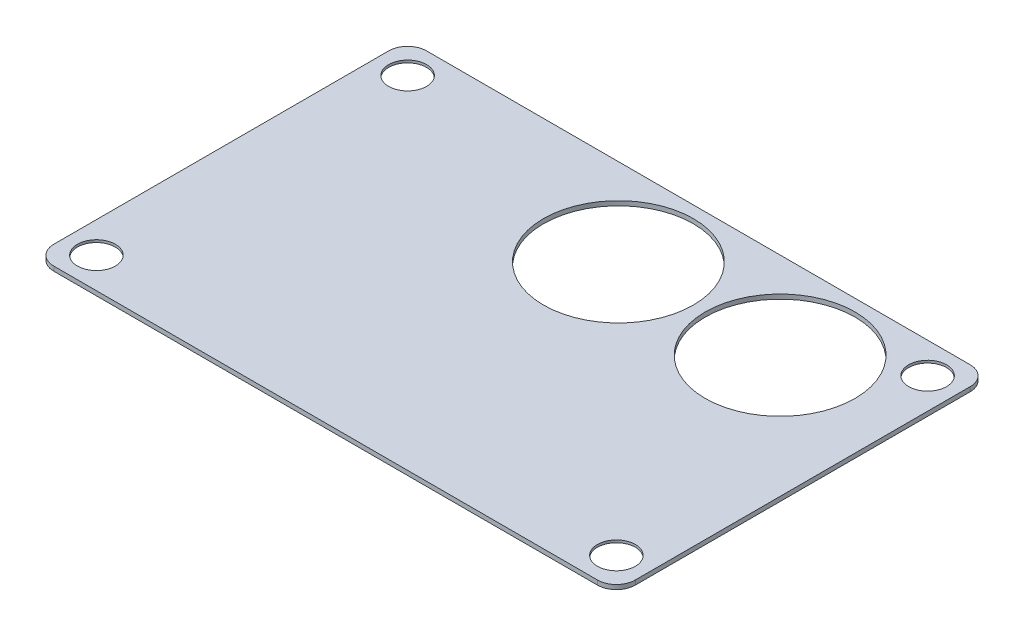
from build123d import *

# Parameters (mm, degrees)
SKETCH1_W               = 78
SKETCH1_H               = 50
PCB_DEPTH               = 0.6
CARD_EDGES_R            = 2.54
SKETCH4_R               = 2.54
MAGNET_HOLE_CUT_DEPTH   = 93.651821353
SKETCH8_R               = 3.33
STEEL_INLAY_CUT_DEPTH   = 0.266625
MIRROR2_COPY_1_SKETCH_R = 2.54
MIRROR2_COPY_1_DEPTH    = 93.651821353
MIRROR2_COPY_2_SKETCH_R = 3.33
MIRROR2_COPY_2_DEPTH    = 0.266625
MIRROR2_COPY_3_SKETCH_R = 2.54
MIRROR2_COPY_3_DEPTH    = 93.651821353
MIRROR2_COPY_4_SKETCH_R = 3.33
MIRROR2_COPY_4_DEPTH    = 0.266625
SKETCH15_R              = 10.05
BATTERY_HOLES_DEPTH     = 93.651821353


with BuildPart() as part:
    # Sketch1 → pcb (new body)
    with BuildSketch(Plane(origin=(0, 0, 0), x_dir=(1, 0, 0), z_dir=(0, 1, 0))):
        with Locations((39, 25)):
            Rectangle(SKETCH1_W, SKETCH1_H)
    extrude(amount=PCB_DEPTH)

    # card edges
    card_edges_edges = [part.edges().sort_by_distance(p)[0] for p in [
        (78, 0.3, -50),
        (0, 0.3, -50),
        (0, 0.3, 0),
        (78, 0.3, 0),
    ]]
    fillet(card_edges_edges, radius=CARD_EDGES_R)

    # Sketch4 → magnet hole cut (cut, through all)
    with BuildSketch(Plane(origin=(0, 0.6, 0), x_dir=(1, 0, 0), z_dir=(0, 1, 0))):
        with Locations((4.1275, 4.13)):
            Circle(SKETCH4_R)
    magnet_hole_cut = extrude(amount=-MAGNET_HOLE_CUT_DEPTH, mode=Mode.SUBTRACT)

    # Sketch8 → steel inlay cut (cut)
    with BuildSketch(Plane.XZ):
        with Locations((4.1275, -4.13)):
            Circle(SKETCH8_R)
    steel_inlay_cut = extrude(amount=-STEEL_INLAY_CUT_DEPTH, mode=Mode.SUBTRACT)

    # Mirror1: magnet hole cut, steel inlay cut across plane
    add(magnet_hole_cut.mirror(Plane.XY.offset(-25)), mode=Mode.SUBTRACT)
    add(steel_inlay_cut.mirror(Plane.XY.offset(-25)), mode=Mode.SUBTRACT)

    # Mirror2 copy 1 sketch → Mirror2 copy 1 (cut, through all)
    with BuildSketch(Plane(origin=(78, 0.6, -50), x_dir=(-1, 0, 0), z_dir=(0, 1, 0))):
        with Locations((4.1275, 4.13)):
            Circle(MIRROR2_COPY_1_SKETCH_R)
    extrude(amount=-MIRROR2_COPY_1_DEPTH, mode=Mode.SUBTRACT)

    # Mirror2 copy 2 sketch → Mirror2 copy 2 (cut)
    with BuildSketch(Plane(origin=(78, 0, -50), x_dir=(-1, 0, 0), z_dir=(0, -1, 0))):
        with Locations((4.1275, -4.13)):
            Circle(MIRROR2_COPY_2_SKETCH_R)
    extrude(amount=-MIRROR2_COPY_2_DEPTH, mode=Mode.SUBTRACT)

    # Mirror2 copy 3 sketch → Mirror2 copy 3 (cut, through all)
    with BuildSketch(Plane(origin=(78, 0.6, 0), x_dir=(-1, 0, 0), z_dir=(0, 1, 0))):
        with Locations((4.1275, -4.13)):
            Circle(MIRROR2_COPY_3_SKETCH_R)
    extrude(amount=-MIRROR2_COPY_3_DEPTH, mode=Mode.SUBTRACT)

    # Mirror2 copy 4 sketch → Mirror2 copy 4 (cut)
    with BuildSketch(Plane(origin=(78, 0, 0), x_dir=(-1, 0, 0), z_dir=(0, -1, 0))):
        with Locations((4.1275, 4.13)):
            Circle(MIRROR2_COPY_4_SKETCH_R)
    extrude(amount=-MIRROR2_COPY_4_DEPTH, mode=Mode.SUBTRACT)

    # Sketch15 → battery_holes (cut, through all)
    with BuildSketch(Plane(origin=(0, 0.6, 0), x_dir=(1, 0, 0), z_dir=(0, 1, 0))):
        with Locations((61.6, 38.3625)):
            Circle(SKETCH15_R)
        with Locations((39.9125, 38.3625)):
            Circle(SKETCH15_R)
    extrude(amount=-BATTERY_HOLES_DEPTH, mode=Mode.SUBTRACT)


solid = part.part
